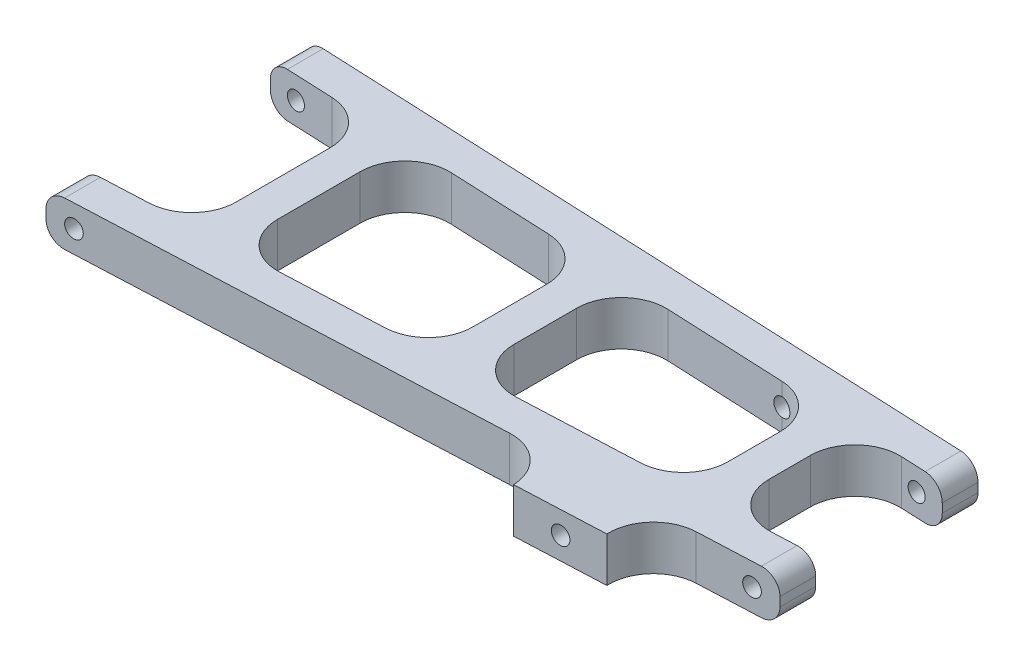
from build123d import *

# Parameters (mm, degrees)
ARM_DEPTH               = 6.35
CUT_EXTRUDE1_DEPTH      = 103.539993784
CUT_EXTRUDE1_DEPTH_BACK = 103.539993784
SKETCH2_R               = 1.27
CUT_EXTRUDE2_DEPTH      = 103.539993784
CUT_EXTRUDE2_DEPTH_BACK = 103.539993784
SKETCH3_R               = 1.27
FILLET1_R               = 2.54
FILLET2_R               = 6.35
FILLET3_R               = 6.35


# Some blends are built 0.0001 mm under size
with BuildPart() as part:
    # Sketch1 → Arm (new body)
    with BuildSketch(Plane(origin=(0, 0, 0), x_dir=(1, 0, 0), z_dir=(0, 1, 0))):
        Polygon((0, -18.5), (69.52, -15.430656357), (69.80008291, -21.774476465), (82.50008291, -21.213764954), (82.22, -14.869944846), (100, -14.08494873), (100, -9), (87.3, -9.560711511), (87.3, 9.560711511), (100, 9), (100, 14.08494873), (0, 18.5), (0, 13.41505127), (15.24, 12.742197457), (15.24, -12.742197457), (0, -13.41505127), align=None)
        Polygon((82.22, -9.784996116), (52.54, -11.095383333), (52.54, 11.095383333), (82.22, 9.784996116), align=None, mode=Mode.SUBTRACT)
        Polygon((20.32, 12.517912852), (20.32, -12.517912852), (47.46, -11.319667937), (47.46, 11.319667937), align=None, mode=Mode.SUBTRACT)
    extrude(amount=ARM_DEPTH)

    # Sketch2 → Cut-Extrude1 (cut, two sides: drawn at the far end of the back side and taken through both)
    with BuildSketch(Plane.XY.offset(-CUT_EXTRUDE1_DEPTH_BACK)):
        with Locations(Location((76.2, 3.175, 0), (0, 0, 180))):
            Circle(SKETCH2_R)
    extrude(amount=CUT_EXTRUDE1_DEPTH + CUT_EXTRUDE1_DEPTH_BACK, mode=Mode.SUBTRACT)

    # Sketch3 → Cut-Extrude2 (cut, two sides: drawn at the far end of the back side and taken through both)
    with BuildSketch(Plane.XY.offset(-CUT_EXTRUDE2_DEPTH_BACK)):
        with Locations((96.19, 3.175)):
            Circle(SKETCH3_R)
        with Locations(Location((3.81, 3.175, 0), (0, 0, 180))):
            Circle(SKETCH3_R)
    extrude(amount=CUT_EXTRUDE2_DEPTH + CUT_EXTRUDE2_DEPTH_BACK, mode=Mode.SUBTRACT)

    # Fillet1
    fillet1_edges = [part.edges().sort_by_distance(p)[0] for p in [
        (0, 0, -15.957525635),
        (100, 0, -11.542474365),
        (100, 0, 11.542474365),
        (0, 0, 15.957525635),
        (100, 6.35, 11.542474365),
        (100, 6.35, -11.542474365),
        (0, 6.35, 15.957525635),
        (0, 6.35, -15.957525635),
    ]]
    fillet(fillet1_edges, radius=FILLET1_R)

    # Fillet2
    # the kernel refuses this fillet: 6.35 mm, written as the material it adds along each edge
    with BuildSketch(Plane(origin=(15.24, 0, 12.742197457), x_dir=(-0.999026788670257, 0, 0.04410754492367402), z_dir=(0, 1, 0)), Plane(origin=(15.24, 0, -12.742197457), x_dir=(0, 0, 1), z_dir=(0, 1, 0))) as fillet2_piece_1:
        with BuildLine():
            CenterArc((FILLET2_R * 0.95682364669, -FILLET2_R), FILLET2_R, 90, 87.472003686)
            Line((-FILLET2_R * 0.0422031419804, -FILLET2_R * 0.955892455076), (0, 0))
            Line((0, 0), (FILLET2_R * 0.95682364669, 0))
        make_face()
    extrude(amount=6.35)
    with BuildSketch(Plane(origin=(87.3, 0, 9.560711511), x_dir=(0.9990267886702568, 0, -0.04410754492367471), z_dir=(0, 1, 0)), Plane(origin=(52.54, 0, 11.095383333), x_dir=(0.9990267886702568, 0, -0.044107544923674566), z_dir=(0, 1, 0)), Plane(origin=(20.32, 0, 12.517912852), x_dir=(0.9990267886702568, 0, -0.044107544923674614), z_dir=(0, 1, 0)), Plane(origin=(87.3, 0, -9.560711511), x_dir=(0, 0, 1), z_dir=(0, 1, 0)), Plane(origin=(52.54, 0, -11.095383333), x_dir=(0, 0, 1), z_dir=(0, 1, 0))) as fillet2_piece_2:
        with BuildLine():
            CenterArc((FILLET2_R * 1.0451246721, FILLET2_R), FILLET2_R, 177.472003686, 92.527996314)
            Line((FILLET2_R * 0.0460978834253, FILLET2_R * 1.04410754492), (0, 0))
            Line((0, 0), (FILLET2_R * 1.0451246721, 0))
        make_face()
    extrude(amount=6.35)
    with BuildSketch(Plane(origin=(47.46, 0, 11.319667937), x_dir=(0, 0, -1), z_dir=(0, 1, 0)), Plane(origin=(47.46, 0, -11.319667937), x_dir=(-0.9990267886702568, 0, -0.04410754492367462), z_dir=(0, 1, 0))) as fillet2_piece_3:
        with BuildLine():
            CenterArc((FILLET2_R * 0.95682364669, FILLET2_R), FILLET2_R, 182.527996314, 87.472003686)
            Line((-FILLET2_R * 0.0422031419804, FILLET2_R * 0.955892455076), (0, 0))
            Line((0, 0), (FILLET2_R * 0.95682364669, 0))
        make_face()
    extrude(amount=6.35)
    with BuildSketch(Plane(origin=(20.32, 0, -12.517912852), x_dir=(0.9990267886702568, 0, 0.044107544923674594), z_dir=(0, 1, 0))) as fillet2_piece_4:
        with BuildLine():
            CenterArc((FILLET2_R * 1.0451246721, -FILLET2_R), FILLET2_R, 90, 92.527996314)
            Line((FILLET2_R * 0.0460978834253, -FILLET2_R * 1.04410754492), (0, 0))
            Line((0, 0), (FILLET2_R * 1.0451246721, 0))
        make_face()
    extrude(amount=6.35)
    with BuildSketch(Plane(origin=(82.22, 0, 9.784996116), x_dir=(-0.9990267886702568, 0, 0.04410754492367457), z_dir=(0, 1, 0))) as fillet2_piece_5_section:
        with BuildLine():
            CenterArc((FILLET2_R * 0.95682364669, -FILLET2_R), FILLET2_R, 90, 87.472003686)
            Line((-FILLET2_R * 0.0422031419804, -FILLET2_R * 0.955892455076), (0, 0))
            Line((0, 0), (FILLET2_R * 0.95682364669, 0))
        make_face()
    fillet2_piece_5 = extrude(amount=6.35, mode=Mode.PRIVATE)
    fillet2_piece_5 = fillet2_piece_5 - Plane(origin=(76.2, 3.175, 9.784996116), x_dir=(-1, 0, 0), z_dir=(0, 0, -1)) * Cylinder(1.27, 38, mode=Mode.PRIVATE)
    add(fillet2_piece_5)
    with BuildSketch(Plane(origin=(82.22, 0, -9.784996116), x_dir=(-0.9990267886702568, 0, -0.04410754492367478), z_dir=(0, 1, 0))) as fillet2_piece_6_section:
        with BuildLine():
            CenterArc((FILLET2_R * 0.95682364669, FILLET2_R), FILLET2_R, 182.527996314, 87.472003686)
            Line((-FILLET2_R * 0.0422031419804, FILLET2_R * 0.955892455076), (0, 0))
            Line((0, 0), (FILLET2_R * 0.95682364669, 0))
        make_face()
    fillet2_piece_6 = extrude(amount=6.35, mode=Mode.PRIVATE)
    fillet2_piece_6 = fillet2_piece_6 - Plane(origin=(76.2, 3.175, -9.784996116), x_dir=(-1, 0, 0), z_dir=(0, 0, 1)) * Cylinder(1.27, 38, mode=Mode.PRIVATE)
    add(fillet2_piece_6)

    # Fillet3
    fillet3_edges = [part.edges().sort_by_distance(p)[0] for p in [
        (69.52, 3.175, 15.430656357),
        (82.22, 3.175, 14.869944846),
    ]]
    fillet(fillet3_edges, radius=FILLET3_R - 0.0001)  # a hair under: the kernel refuses the full size


solid = part.part
